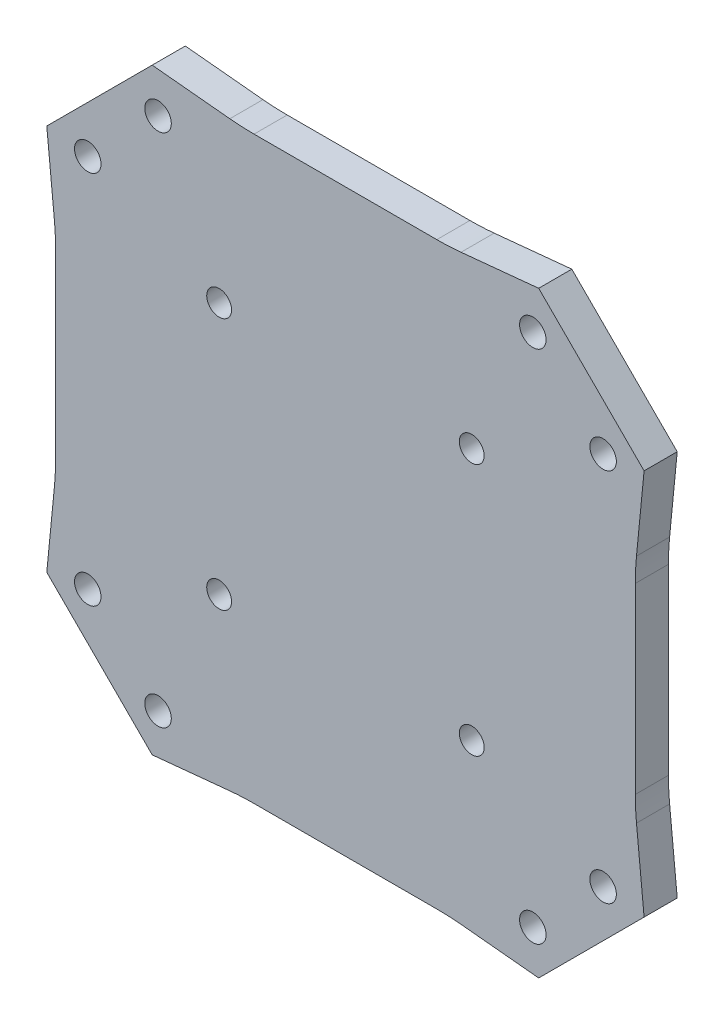
from build123d import *

# Parameters (mm, degrees)
SKETCH1_R           = 1.6
BOSS_EXTRUDE1_DEPTH = 4
CUT_EXTRUDE7_DEPTH  = 1
CUT_EXTRUDE8_DEPTH  = 1.5
SKETCH8_R           = 4
BOSS_EXTRUDE5_DEPTH = 1.5
SKETCH13_R          = 1.5
CUT_EXTRUDE12_DEPTH = 17.5
CIRPATTERN2_COUNT   = 4
FILLET2_R           = 2
FILLET3_R           = 30


with BuildPart() as part:
    # Sketch1 → Boss-Extrude1 (new body)
    with BuildSketch(Plane.XY):
        Polygon((12.5, 35), (-12.5, 35), (-23.334523779, 36.062445841), (-36.062445841, 23.334523779), (-35, 12.5), (-35, -12.5), (-36.062445841, -23.334523779), (-23.334523779, -36.062445841), (-12.5, -35), (12.5, -35), (23.334523779, -36.062445841), (36.062445841, -23.334523779), (35, -12.5), (35, 12.5), (36.062445841, 23.334523779), (23.334523779, 36.062445841), align=None)
        with Locations((31.112698372, 22.627416998)):
            Circle(SKETCH1_R, mode=Mode.SUBTRACT)
        with Locations((22.627416998, 31.112698372)):
            Circle(SKETCH1_R, mode=Mode.SUBTRACT)
        with Locations((22.627416998, -31.112698372)):
            Circle(SKETCH1_R, mode=Mode.SUBTRACT)
        with Locations((31.112698372, -22.627416998)):
            Circle(SKETCH1_R, mode=Mode.SUBTRACT)
        with Locations((-31.112698372, -22.627416998)):
            Circle(SKETCH1_R, mode=Mode.SUBTRACT)
        with Locations((-22.627416998, -31.112698372)):
            Circle(SKETCH1_R, mode=Mode.SUBTRACT)
        with Locations((-22.627416998, 31.112698372)):
            Circle(SKETCH1_R, mode=Mode.SUBTRACT)
        with Locations((-31.112698372, 22.627416998)):
            Circle(SKETCH1_R, mode=Mode.SUBTRACT)
    extrude(amount=BOSS_EXTRUDE1_DEPTH)

    # 3DSketch1 → Cut-Extrude7 (cut, symmetric)
    with BuildSketch(Plane(origin=(-17.522554566, 30.250476628, 0.3336629), x_dir=(0.5012316605773316, -0.8653131354803826, 0), z_dir=(0, 0, -1))):
        Polygon((0, 0), (17.565718245, -30.324993267), (34.958993903, -34.958993903), (65.28398717, -17.393275658), (69.917987806, 0), (52.352269561, 30.324993267), (34.958993903, 34.958993903), (4.634000637, 17.393275658), align=None)
    extrude(amount=CUT_EXTRUDE7_DEPTH, both=True, mode=Mode.SUBTRACT)

    # Sketch7 → Cut-Extrude8 (cut)
    with BuildSketch(Plane(origin=(0, 0, 1.3336629), x_dir=(-1, 0, 0), z_dir=(0, 0, -1))):
        with BuildLine():
            Line((-15, -4.506640856), (-15, 4.506640856))
            ThreePointArc((-15, 4.506640856), (-15.314344635, 5.843523522), (-16.191503508, 6.900244925))
            Line((-16.191503508, 6.900244925), (-25.441980135, 13.889477085))
            ThreePointArc((-25.441980135, 13.889477085), (-28.587359293, 14.181528381), (-30.250476628, 11.495873016))
            Line((-30.250476628, 11.495873016), (-30.250476628, -11.495873016))
            ThreePointArc((-30.250476628, -11.495873016), (-28.587359293, -14.181528381), (-25.441980135, -13.889477085))
            Line((-25.441980135, -13.889477085), (-16.191503508, -6.900244925))
            ThreePointArc((-16.191503508, -6.900244925), (-15.314344635, -5.843523522), (-15, -4.506640856))
        make_face()
        with BuildLine():
            Line((13.889477085, 25.441980135), (6.900244925, 16.191503508))
            ThreePointArc((6.900244925, 16.191503508), (5.843523522, 15.314344635), (4.506640856, 15))
            Line((4.506640856, 15), (-4.506640856, 15))
            ThreePointArc((-4.506640856, 15), (-5.843523522, 15.314344635), (-6.900244925, 16.191503508))
            Line((-6.900244925, 16.191503508), (-13.889477085, 25.441980135))
            ThreePointArc((-13.889477085, 25.441980135), (-14.181528381, 28.587359293), (-11.495873016, 30.250476628))
            Line((-11.495873016, 30.250476628), (11.495873016, 30.250476628))
            ThreePointArc((11.495873016, 30.250476628), (14.181528381, 28.587359293), (13.889477085, 25.441980135))
        make_face()
        with BuildLine():
            Line((25.441980135, -13.889477085), (16.191503508, -6.900244925))
            ThreePointArc((16.191503508, -6.900244925), (15.314344635, -5.843523522), (15, -4.506640856))
            Line((15, -4.506640856), (15, 4.506640856))
            ThreePointArc((15, 4.506640856), (15.314344635, 5.843523522), (16.191503508, 6.900244925))
            Line((16.191503508, 6.900244925), (25.441980135, 13.889477085))
            ThreePointArc((25.441980135, 13.889477085), (28.587359293, 14.181528381), (30.250476628, 11.495873016))
            Line((30.250476628, 11.495873016), (30.250476628, -11.495873016))
            ThreePointArc((30.250476628, -11.495873016), (28.587359293, -14.181528381), (25.441980135, -13.889477085))
        make_face()
        with BuildLine():
            Line((-13.889477085, -25.441980135), (-6.900244925, -16.191503508))
            ThreePointArc((-6.900244925, -16.191503508), (-5.843523522, -15.314344635), (-4.506640856, -15))
            Line((-4.506640856, -15), (4.506640856, -15))
            ThreePointArc((4.506640856, -15), (5.843523522, -15.314344635), (6.900244925, -16.191503508))
            Line((6.900244925, -16.191503508), (13.889477085, -25.441980135))
            ThreePointArc((13.889477085, -25.441980135), (14.181528381, -28.587359293), (11.495873016, -30.250476628))
            Line((11.495873016, -30.250476628), (-11.495873016, -30.250476628))
            ThreePointArc((-11.495873016, -30.250476628), (-14.181528381, -28.587359293), (-13.889477085, -25.441980135))
        make_face()
    extrude(amount=-CUT_EXTRUDE8_DEPTH, mode=Mode.SUBTRACT)

    # Sketch8 → Boss-Extrude5 (add)
    with BuildSketch(Plane(origin=(0, 0, 1.3336629), x_dir=(-1, 0, 0), z_dir=(0, 0, -1))):
        with Locations((15.25, 15.25)):
            Circle(SKETCH8_R)
    boss_extrude5 = extrude(amount=BOSS_EXTRUDE5_DEPTH)

    # Sketch13 → Cut-Extrude12 (cut)
    with BuildSketch(Plane(origin=(0, 0, -0.1663371), x_dir=(-1, 0, 0), z_dir=(0, 0, -1))):
        with Locations((15.25, 15.25)):
            Circle(SKETCH13_R)
    cut_extrude12 = extrude(amount=-CUT_EXTRUDE12_DEPTH, mode=Mode.SUBTRACT)

    # CirPattern2: Boss-Extrude5, Cut-Extrude12 ×4 about axis
    cirpattern2_axis = Axis((0, 0, 0), (0, 0, 1))
    add([boss_extrude5.rotate(cirpattern2_axis, i * 360 / CIRPATTERN2_COUNT) for i in range(1, CIRPATTERN2_COUNT)])
    add([cut_extrude12.rotate(cirpattern2_axis, i * 360 / CIRPATTERN2_COUNT) for i in range(1, CIRPATTERN2_COUNT)], mode=Mode.SUBTRACT)

    # Fillet2
    # the kernel refuses this fillet: 2 mm, written as the material it adds along each edge
    with BuildSketch(Plane(origin=(-15.25, 15.25, 1.3336629), x_dir=(-1, 0, 0), z_dir=(0, -1, 0))) as fillet2_piece_1:
        with BuildLine():
            CenterArc((5.936491673, 2), FILLET2_R, 194.477512186, 75.522487814)
            Line((4, 1.5), (3.961270167, 1.49))
            ThreePointArc((3.961270167, 1.49), (3.96, 0.75), (3.96, 0))
            Line((3.96, 0), (4, -0.04))
            Line((4, -0.04), (5.936491673, -0.04))
            Line((5.936491673, -0.04), (5.936491673, 0))
        make_face()
    revolve(axis=Axis((-15.25, 15.25, 1.3336629), (0, 0, -1)))
    with BuildSketch(Plane(origin=(-15.25, -15.25, 1.3336629), x_dir=(0, -1, 0), z_dir=(1, 0, 0))) as fillet2_piece_2:
        with BuildLine():
            CenterArc((5.936491673, 2), FILLET2_R, 194.477512186, 75.522487814)
            Line((4, 1.5), (3.961270167, 1.49))
            ThreePointArc((3.961270167, 1.49), (3.96, 0.75), (3.96, 0))
            Line((3.96, 0), (4, -0.04))
            Line((4, -0.04), (5.936491673, -0.04))
            Line((5.936491673, -0.04), (5.936491673, 0))
        make_face()
    revolve(axis=Axis((-15.25, -15.25, 1.3336629), (0, 0, -1)))
    with BuildSketch(Plane(origin=(15.25, -15.25, 1.3336629), x_dir=(1, 0, 0), z_dir=(0, 1, 0))) as fillet2_piece_3:
        with BuildLine():
            CenterArc((5.936491673, 2), FILLET2_R, 194.477512186, 75.522487814)
            Line((4, 1.5), (3.961270167, 1.49))
            ThreePointArc((3.961270167, 1.49), (3.96, 0.75), (3.96, 0))
            Line((3.96, 0), (4, -0.04))
            Line((4, -0.04), (5.936491673, -0.04))
            Line((5.936491673, -0.04), (5.936491673, 0))
        make_face()
    revolve(axis=Axis((15.25, -15.25, 1.3336629), (0, 0, -1)))
    with BuildSketch(Plane(origin=(15.25, 15.25, 1.3336629), x_dir=(0, 1, 0), z_dir=(-1, 0, 0))) as fillet2_piece_4:
        with BuildLine():
            CenterArc((5.936491673, 2), FILLET2_R, 194.477512186, 75.522487814)
            Line((4, 1.5), (3.961270167, 1.49))
            ThreePointArc((3.961270167, 1.49), (3.96, 0.75), (3.96, 0))
            Line((3.96, 0), (4, -0.04))
            Line((4, -0.04), (5.936491673, -0.04))
            Line((5.936491673, -0.04), (5.936491673, 0))
        make_face()
    revolve(axis=Axis((15.25, 15.25, 1.3336629), (0, 0, -1)))

    # Fillet3
    # the kernel refuses this fillet: 30 mm, written as the material it adds along each edge
    with BuildSketch(Plane(origin=(-12.5, 35, 0), x_dir=(1, 0, 0), z_dir=(0, 0, 1)), Plane(origin=(-12.5, -35, 0), x_dir=(-0.995226405289247, -0.09759304388655768, 0), z_dir=(0, 0, 1)), Plane(origin=(-35, -12.5, 0), x_dir=(0, 1, 0), z_dir=(0, 0, 1)), Plane(origin=(-35, 12.5, 0), x_dir=(-0.09759304388655696, 0.9952264052892469, 0), z_dir=(0, 0, 1))) as fillet3_piece_1:
        with BuildLine():
            CenterArc((FILLET3_R * 0.0489132680019, FILLET3_R), FILLET3_R, 264.399415997, 5.600584003)
            Line((-FILLET3_R * 0.0486797758845, FILLET3_R * 0.00477359471074), (0, 0))
            Line((0, 0), (FILLET3_R * 0.0489132680019, 0))
        make_face()
    extrude(amount=4)
    with BuildSketch(Plane(origin=(12.5, 35, 0), x_dir=(-1, 0, 0), z_dir=(0, 0, 1)), Plane(origin=(35, 12.5, 0), x_dir=(0.09759304388646403, 0.9952264052892561, 0), z_dir=(0, 0, 1)), Plane(origin=(35, -12.5, 0), x_dir=(0, 1, 0), z_dir=(0, 0, 1)), Plane(origin=(12.5, -35, 0), x_dir=(0.9952264052892558, -0.09759304388646729, 0), z_dir=(0, 0, 1))) as fillet3_piece_2:
        with BuildLine():
            CenterArc((FILLET3_R * 0.048913268002, -FILLET3_R), FILLET3_R, 90, 5.600584003)
            Line((-FILLET3_R * 0.0486797758846, -FILLET3_R * 0.00477359471075), (0, 0))
            Line((0, 0), (FILLET3_R * 0.048913268002, 0))
        make_face()
    extrude(amount=4)


solid = part.part
